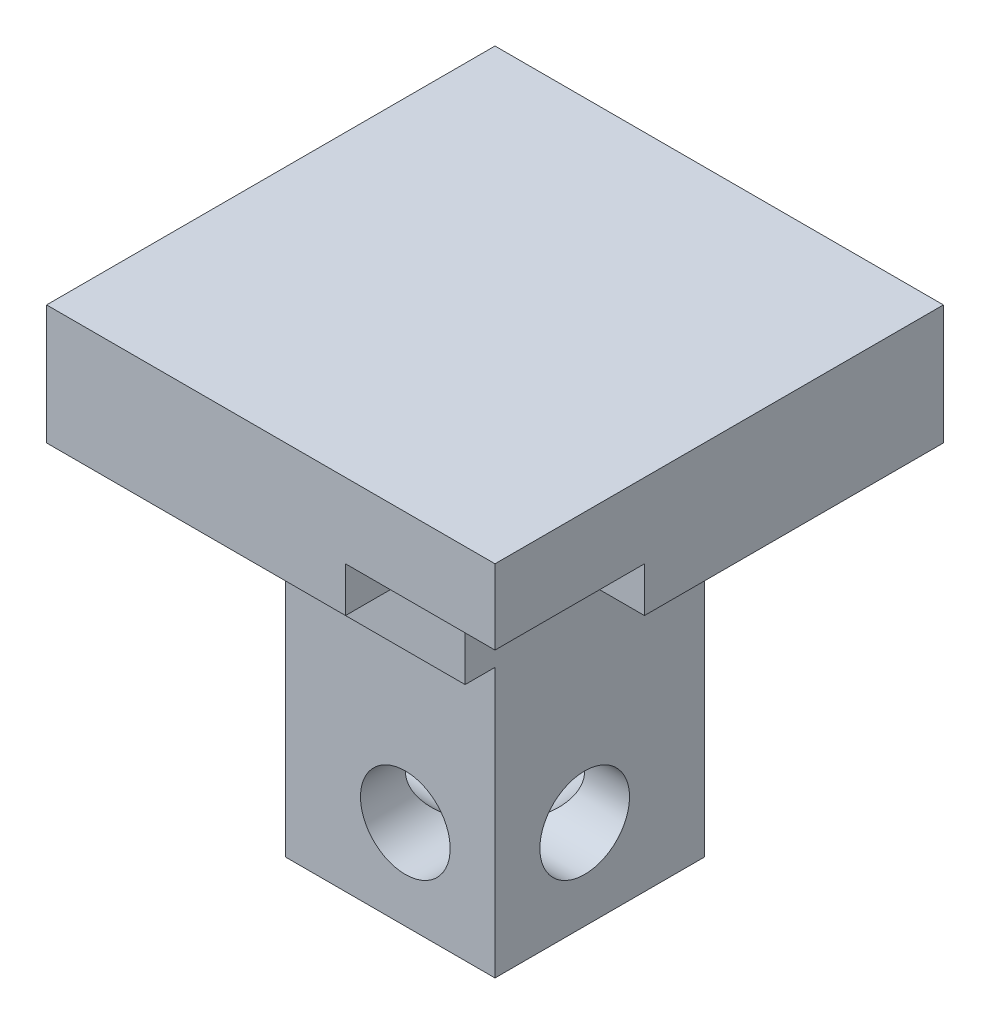
from build123d import *

# Parameters (mm, degrees)
SZKIC1_W                    = 16
SZKIC1_H                    = 40
SZKIC1_R                    = 3
DODANIE_WYCI_GNI_CIE1_DEPTH = 16
SZKIC2_R                    = 3
WYTNIJ_WYCI_GNI_CIE1_DEPTH  = 41.841155713
SZKIC3_W                    = 16
SZKIC3_H                    = 18
WYTNIJ_WYCI_GNI_CIE2_DEPTH  = 2
SZKIC4_W                    = 16
SZKIC4_H                    = 22
WYTNIJ_WYCI_GNI_CIE3_DEPTH  = 2
SZKIC5_W                    = 30
SZKIC5_H                    = 30
DODANIE_WYCI_GNI_CIE2_DEPTH = 5
ZAOKR_GLENIE1_R             = 2
SZKIC6_W                    = 20
SZKIC6_H                    = 3
SZKIC6_W_2                  = 3
SZKIC6_H_2                  = 20
DODANIE_WYCI_GNI_CIE3_DEPTH = 3


with BuildPart() as part:
    # Szkic1 → Dodanie-wyciągnięcie1 (new body)
    with BuildSketch(Plane(origin=(0, 0, 0), x_dir=(0, 0, -1), z_dir=(1, 0, 0))):
        with Locations((0, 14)):
            Rectangle(SZKIC1_W, SZKIC1_H)
        Circle(SZKIC1_R, mode=Mode.SUBTRACT)
    extrude(amount=DODANIE_WYCI_GNI_CIE1_DEPTH)

    # Szkic2 → Wytnij-wyciągnięcie1 (cut, through all)
    with BuildSketch(Plane.XY.offset(8)):
        with Locations((8, 0)):
            Circle(SZKIC2_R)
    extrude(amount=-WYTNIJ_WYCI_GNI_CIE1_DEPTH, mode=Mode.SUBTRACT)

    # Szkic3 → Wytnij-wyciągnięcie2 (cut)
    with BuildSketch(Plane.XY.offset(8)):
        with Locations((8, 3)):
            Rectangle(SZKIC3_W, SZKIC3_H)
    extrude(amount=-WYTNIJ_WYCI_GNI_CIE2_DEPTH, mode=Mode.SUBTRACT)

    # Szkic4 → Wytnij-wyciągnięcie3 (cut)
    with BuildSketch(Plane(origin=(16, 0, 0), x_dir=(0, 0, -1), z_dir=(1, 0, 0))):
        with Locations((0, 5)):
            Rectangle(SZKIC4_W, SZKIC4_H)
    extrude(amount=-WYTNIJ_WYCI_GNI_CIE3_DEPTH, mode=Mode.SUBTRACT)

    # Szkic5 → Dodanie-wyciągnięcie2 (add)
    with BuildSketch(Plane(origin=(0, 34, 0), x_dir=(1, 0, 0), z_dir=(0, 1, 0))):
        with Locations((15, -7)):
            Rectangle(SZKIC5_W, SZKIC5_H)
    extrude(amount=-DODANIE_WYCI_GNI_CIE2_DEPTH)

    # Zaokrąglenie1
    zaokr_glenie1_edges = [part.edges().sort_by_distance(p)[0] for p in [
        (8, 29, 8),
        (16, 29, 0),
    ]]
    fillet(zaokr_glenie1_edges, radius=ZAOKR_GLENIE1_R)

    # Szkic6 → Dodanie-wyciągnięcie3 (add)
    with BuildSketch(Plane.XZ.offset(-29)):
        with Locations((10, 20.5)):
            Rectangle(SZKIC6_W, SZKIC6_H)
        with Locations((28.5, 2)):
            Rectangle(SZKIC6_W_2, SZKIC6_H_2)
    extrude(amount=DODANIE_WYCI_GNI_CIE3_DEPTH)


solid = part.part
